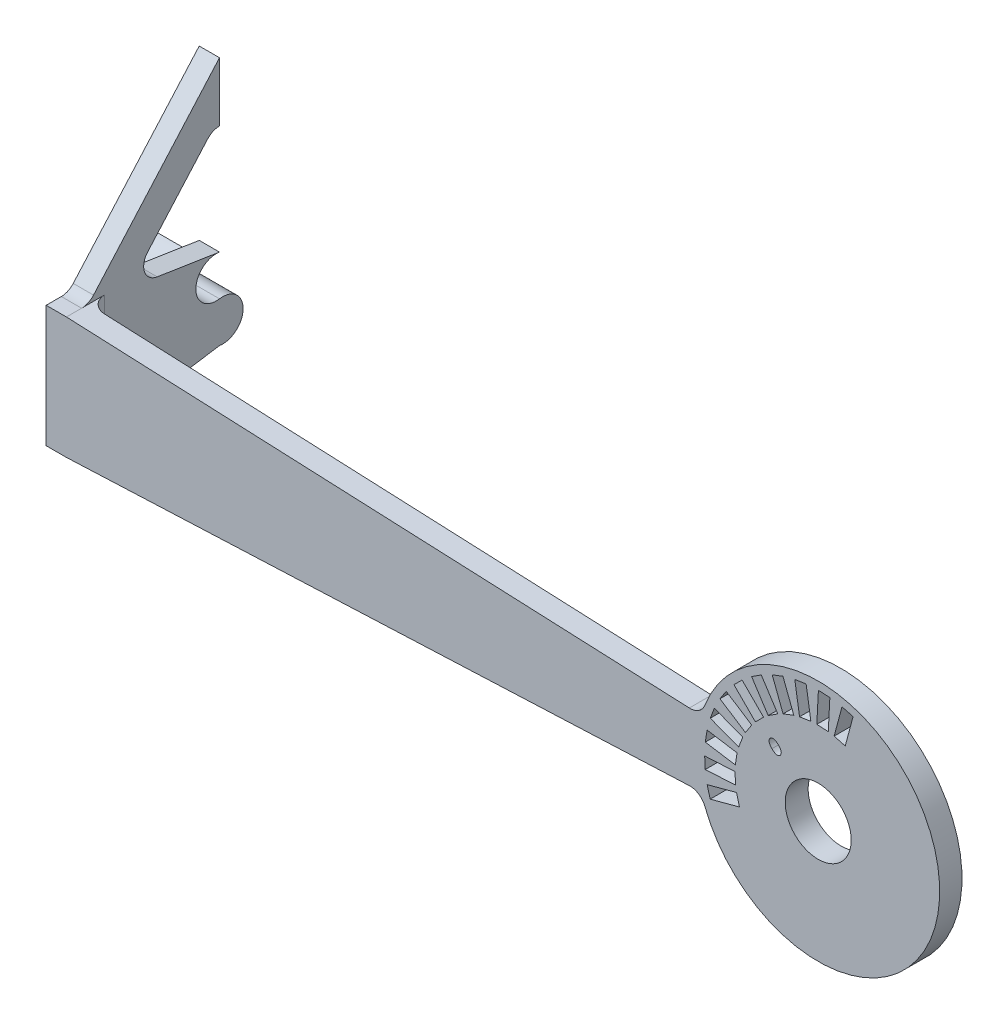
from build123d import *

# Parameters (mm, degrees)
SKETCH1_R           = 9.525
SKETCH1_R_2         = 5.175
BOSS_EXTRUDE1_DEPTH = 3.6
BOSS_EXTRUDE2_DEPTH = 3.5
SKETCH3_R           = 19.05
SKETCH3_R_2         = 5.175
BOSS_EXTRUDE3_DEPTH = 3.5
CUT_EXTRUDE1_DEPTH  = 95.573202468
BOSS_EXTRUDE4_DEPTH = 3.175
BOSS_EXTRUDE5_DEPTH = 6.35
BOSS_EXTRUDE6_DEPTH = 3.18
FILLET1_R           = 2.5


with BuildPart() as part:
    # Sketch1 → Boss-Extrude1 (new body)
    with BuildSketch(Plane.XY):
        with Locations((27.25, 7.75)):
            Circle(SKETCH1_R)
        with Locations((27.25, 7.75)):
            Circle(SKETCH1_R_2, mode=Mode.SUBTRACT)
    extrude(amount=-BOSS_EXTRUDE1_DEPTH)

    # Sketch2 → Boss-Extrude2 (add)
    with BuildSketch(Plane.XY):
        Polygon((18.995, 12.501904881), (-90.625, 17.288017443), (-90.625, -1.788017443), (18.995, 2.998095119), align=None)
    extrude(amount=-BOSS_EXTRUDE2_DEPTH)

    # Sketch3 → Boss-Extrude3 (add)
    with BuildSketch(Plane.XY):
        with Locations((27.25, 7.75)):
            Circle(SKETCH3_R)
        with Locations((27.25, 7.75)):
            Circle(SKETCH3_R_2, mode=Mode.SUBTRACT)
    extrude(amount=-BOSS_EXTRUDE3_DEPTH)

    # Sketch4 → Cut-Extrude1 (cut, through all)
    # profile 1 of 12: a face of its own
    with BuildSketch(Plane.XY):
        Polygon((19.405357851, 18.177218987), (16.811514446, 22.171387567), (18.321121469, 23.15173783), (20.914964873, 19.15756925), align=None)
    # profile 2 of 12: a face of its own
    with BuildSketch(Plane.XY):
        Polygon((17.408841373, 16.318366421), (18.681633579, 17.591158627), (15.314037534, 20.958754673), (14.041245327, 19.685962466), align=None)
    # profile 3 of 12: a face of its own
    with BuildSketch(Plane.XY):
        Polygon((21.744722833, 19.580352047), (20.037995473, 24.026528829), (21.718440241, 24.671591138), (23.425167601, 20.225414357), align=None)
    # profile 4 of 12: a face of its own
    with BuildSketch(Plane.XY):
        Polygon((24.324694845, 20.466441955), (23.579675705, 25.170307677), (25.357514718, 25.451889714), (26.102533858, 20.748023992), align=None)
    # profile 5 of 12: a face of its own
    with BuildSketch(Plane.XY):
        Polygon((27.032516729, 20.796762329), (27.281766721, 25.552735489), (29.079299883, 25.458530767), (28.830049892, 20.702557608), align=None)
    # profile 6 of 12: a face of its own
    with BuildSketch(Plane.XY):
        Polygon((29.749843676, 20.556876584), (30.982469378, 25.157098332), (32.721135866, 24.691224051), (31.488510163, 20.091002303), align=None)
    # profile 7 of 12: a face of its own
    with BuildSketch(Plane.XY):
        Polygon((15.84243075, 14.085035127), (11.84826217, 16.678878531), (12.828612433, 18.188485554), (16.822781013, 15.594642149), align=None)
    # profile 8 of 12: a face of its own
    with BuildSketch(Plane.XY):
        Polygon((14.774585643, 11.574832399), (10.328408862, 13.281559759), (10.973471171, 14.962004527), (15.419647953, 13.255277167), align=None)
    # profile 9 of 12: a face of its own
    with BuildSketch(Plane.XY):
        Polygon((14.251976008, 8.897466142), (9.548110286, 9.642485282), (9.829692323, 11.420324295), (14.533558045, 10.675305155), align=None)
    # profile 10 of 12: a face of its own
    with BuildSketch(Plane.XY):
        Polygon((14.297442392, 6.169950108), (9.541469233, 5.920700117), (9.447264511, 7.718233279), (14.203237671, 7.967483271), align=None)
    # profile 11 of 12: a face of its own
    with BuildSketch(Plane.XY):
        Polygon((14.908997697, 3.511489837), (10.308775949, 2.278864134), (9.842901668, 4.017530622), (14.443123416, 5.250156324), align=None)
    # profile 12 of 12: a face of its own
    with BuildSketch(Plane.XY):
        with BuildLine():
            add(Edge.make_bspline(
                [(19.996175693, 13.983105039), (19.972549804, 14.006974852), (19.926684107, 14.053314085), (19.862635122, 14.123340739), (19.804807719, 14.191245488), (19.753115011, 14.256928744), (19.706902346, 14.320187557), (19.667123485, 14.381475924), (19.633241886, 14.440499093), (19.605838218, 14.49786121), (19.583891907, 14.553730575), (19.565373741, 14.60828689), (19.550882076, 14.662068546), (19.540580443, 14.715204363), (19.534737441, 14.767524979), (19.532388566, 14.819113596), (19.53464102, 14.869868179), (19.540484051, 14.919643175), (19.550380726, 14.968074585), (19.563399735, 15.015027998), (19.579921539, 15.060371004), (19.600563009, 15.10350851), (19.62372625, 15.145488903), (19.651184569, 15.185108897), (19.681148524, 15.223804161), (19.703943722, 15.247425917), (19.715479913, 15.259380413)],
                knots=[0, 0, 0, 0, 1.644941701, 3.193378015, 4.647145852, 6.012736372, 7.286740979, 8.483061719, 9.58992218, 10.61798452, 11.593737178, 12.528549707, 13.438735705, 14.319919232, 15.176948591, 16.015348648, 16.846831638, 17.662602897, 18.467729349, 19.265590275, 20.047523624, 20.827953815, 21.605954429, 22.393232775, 23.186847407, 24, 24, 24, 24], degree=3))
            add(Edge.make_bspline(
                [(19.715479913, 15.259380413), (19.72757601, 15.271056951), (19.751480133, 15.294131948), (19.79059328, 15.32453002), (19.830653616, 15.352371474), (19.872934823, 15.376073956), (19.916815537, 15.396640202), (19.962550005, 15.413433609), (20.009989946, 15.427159873), (20.059028168, 15.437329522), (20.109640093, 15.443588369), (20.161391726, 15.446416818), (20.214253243, 15.443872509), (20.268139075, 15.438159389), (20.323009446, 15.427596366), (20.379119371, 15.413908829), (20.435954787, 15.394752005), (20.494277642, 15.372380194), (20.553991919, 15.345222785), (20.614763563, 15.31181632), (20.6768047, 15.272675401), (20.740699924, 15.228555913), (20.805586165, 15.178199697), (20.871982932, 15.122240246), (20.939915396, 15.060760529), (20.984561985, 15.016868227), (21.007443722, 14.994373068)],
                knots=[0, 0, 0, 0, 0.81750105, 1.615533254, 2.407168602, 3.189397808, 3.970901104, 4.762954563, 5.55742278, 6.372083968, 7.196957306, 8.037000563, 8.890477321, 9.76918381, 10.671577351, 11.607318308, 12.577284202, 13.587520184, 14.64617593, 15.76641423, 16.959043917, 18.21433275, 19.543145185, 20.953794228, 22.438794936, 24, 24, 24, 24], degree=3))
            add(Edge.make_bspline(
                [(21.007443722, 14.994373068), (21.029939345, 14.971491973), (21.07369258, 14.926989007), (21.134906952, 14.859351767), (21.190415056, 14.793244214), (21.24085702, 14.728727202), (21.285167215, 14.665378577), (21.324082766, 14.603618046), (21.35744776, 14.543475592), (21.384594418, 14.48417647), (21.406973112, 14.426279284), (21.426121387, 14.369867226), (21.439873538, 14.314050657), (21.450373252, 14.259306853), (21.456117386, 14.205282675), (21.45863553, 14.152136819), (21.455811599, 14.099963135), (21.449552444, 14.048928037), (21.439380503, 13.999468399), (21.425663125, 13.951600834), (21.408844197, 13.905459094), (21.388425087, 13.861212706), (21.364450808, 13.818808922), (21.336898184, 13.778413534), (21.306335612, 13.739270233), (21.283273208, 13.715357657), (21.271603044, 13.703257283)],
                knots=[0, 0, 0, 0, 1.562235313, 3.038495437, 4.440379466, 5.764626062, 7.024677084, 8.202776689, 9.317717587, 10.370816988, 11.375304419, 12.339374423, 13.269058028, 14.172047064, 15.051333417, 15.912249674, 16.759720868, 17.591966788, 18.41390586, 19.215513145, 20.014546285, 20.802808402, 21.585553806, 22.383400645, 23.181959475, 24, 24, 24, 24], degree=3))
            add(Edge.make_bspline(
                [(21.271603044, 13.703257283), (21.259629026, 13.691746239), (21.23604856, 13.66907751), (21.197734192, 13.638805411), (21.158183947, 13.611660672), (21.116515089, 13.588202529), (21.073534989, 13.567814799), (21.028537333, 13.551158533), (20.981994239, 13.538163004), (20.933989646, 13.528262893), (20.884634953, 13.522407258), (20.834167195, 13.520202748), (20.782683445, 13.522376174), (20.73042296, 13.5289079), (20.67731692, 13.539143901), (20.623181435, 13.553199413), (20.568109964, 13.571523386), (20.511768493, 13.594048796), (20.454021813, 13.622036447), (20.394346939, 13.655485363), (20.332806089, 13.695249792), (20.269074183, 13.740726075), (20.203509794, 13.792477155), (20.136108776, 13.850566204), (20.065946419, 13.913865736), (20.019874065, 13.959587171), (19.996175693, 13.983105039)],
                knots=[0, 0, 0, 0, 0.813987375, 1.602987522, 2.391074088, 3.163837422, 3.945068801, 4.721304689, 5.513312182, 6.312473106, 7.122201215, 7.947613738, 8.786874495, 9.645595022, 10.52768317, 11.43703601, 12.385957169, 13.371717227, 14.410080332, 15.530148071, 16.72394133, 18.000834515, 19.367826948, 20.817813834, 22.363169582, 24, 24, 24, 24], degree=3))
        make_face()
        with BuildLine():
            add(Edge.make_bspline(
                [(20.139491665, 14.120484847), (20.159842261, 14.10026479), (20.199282005, 14.06107803), (20.258825996, 14.006696987), (20.315157902, 13.956648767), (20.36946228, 13.91227584), (20.421015188, 13.872453316), (20.470698769, 13.838793642), (20.517294119, 13.809391318), (20.562274922, 13.785969667), (20.60570856, 13.766694324), (20.648080537, 13.750402661), (20.6900298, 13.737655615), (20.731300233, 13.728383676), (20.771914432, 13.721759849), (20.812064975, 13.718808576), (20.851623834, 13.719298353), (20.902639916, 13.723732634), (20.963368961, 13.736271903), (21.030845369, 13.761355865), (21.091551409, 13.796275379), (21.125667075, 13.82699342), (21.142703471, 13.842333137)],
                knots=[0, 0, 0, 0, 1.478828575, 2.865990936, 4.156734116, 5.36308544, 6.480889949, 7.513666501, 8.455984072, 9.319688948, 10.125381605, 10.904881632, 11.658652575, 12.383407565, 13.084213992, 13.778321268, 14.456017801, 15.121659285, 16.41638644, 17.638501444, 18.820734642, 20, 20, 20, 20], degree=3))
            add(Edge.make_bspline(
                [(21.142703471, 13.842333137), (21.158237309, 13.859333277), (21.189151543, 13.89316563), (21.223390961, 13.953683956), (21.248748637, 14.019779969), (21.261375212, 14.079417608), (21.265678182, 14.129451086), (21.266398281, 14.168334547), (21.262604874, 14.20785819), (21.256376505, 14.24827996), (21.246514017, 14.289516324), (21.233214252, 14.331341198), (21.217255365, 14.3741679), (21.20384511, 14.402126104), (21.196976975, 14.41644505)],
                knots=[0, 0, 0, 0, 1.339481627, 2.665731908, 4.025256516, 5.457778452, 6.202644314, 6.952873897, 7.722377096, 8.515238795, 9.337057588, 10.192268171, 11.074160362, 12, 12, 12, 12], degree=3))
            add(Edge.make_bspline(
                [(21.196976975, 14.41644505), (21.187973627, 14.434350806), (21.169636182, 14.47082011), (21.138179389, 14.524604008), (21.102557105, 14.578418398), (21.064470083, 14.633337931), (21.020981154, 14.687380173), (20.975094965, 14.742656801), (20.924859167, 14.797821639), (20.889404387, 14.83392842), (20.87133595, 14.852329131)],
                knots=[0, 0, 0, 0, 0.879877645, 1.792078736, 2.733637099, 3.713363695, 4.725250154, 5.778099888, 6.867676946, 8, 8, 8, 8], degree=3))
            add(Edge.make_bspline(
                [(20.87133595, 14.852329131), (20.85293091, 14.870394121), (20.817032712, 14.905629066), (20.762551079, 14.955367796), (20.709270708, 15.001073456), (20.657080441, 15.043043344), (20.605259068, 15.080077675), (20.554916646, 15.113936398), (20.50519563, 15.143058684), (20.456779694, 15.168776163), (20.409426539, 15.190288012), (20.363298462, 15.208334264), (20.31839389, 15.222725096), (20.274695443, 15.233953882), (20.232016746, 15.241307261), (20.190582362, 15.244613497), (20.150298797, 15.244724339), (20.099268913, 15.240215062), (20.039015716, 15.227597661), (19.972406236, 15.202799422), (19.911999572, 15.169092426), (19.878484301, 15.13852322), (19.861763968, 15.123272641)],
                knots=[0, 0, 0, 0, 1.331365774, 2.596768798, 3.807708333, 4.955277549, 6.052926775, 7.095188675, 8.086337056, 9.026368116, 9.92436562, 10.769928982, 11.582219143, 12.357378997, 13.097541491, 13.815019859, 14.500931769, 15.174783094, 16.457052075, 17.664667297, 18.834932833, 20, 20, 20, 20], degree=3))
            add(Edge.make_bspline(
                [(19.861763968, 15.123272641), (19.846235795, 15.106269619), (19.815119572, 15.072198013), (19.780593138, 15.01114956), (19.755313654, 14.944098329), (19.74268388, 14.88378236), (19.738333486, 14.833183193), (19.737770771, 14.79390012), (19.740933039, 14.754081851), (19.746875648, 14.713394638), (19.756141644, 14.672123078), (19.769056969, 14.630225368), (19.785373303, 14.587876991), (19.804420811, 14.544195974), (19.828111656, 14.499075995), (19.857227018, 14.452165818), (19.891065617, 14.402451645), (19.930829853, 14.350856026), (19.975390734, 14.296573577), (20.025112965, 14.239683187), (20.080125163, 14.180441993), (20.119308315, 14.140869004), (20.139491665, 14.120484847)],
                knots=[0, 0, 0, 0, 1.184098183, 2.372762314, 3.588199925, 4.868807811, 5.53452642, 6.205014416, 6.891934544, 7.591722619, 8.32367034, 9.070557309, 9.850147652, 10.662595738, 11.526400688, 12.475033872, 13.507930086, 14.625864108, 15.832355206, 17.128728501, 18.521000081, 20, 20, 20, 20], degree=3))
        make_face(mode=Mode.SUBTRACT)
    extrude(amount=-CUT_EXTRUDE1_DEPTH, mode=Mode.SUBTRACT)


with BuildPart() as cut_extrude1_kept_piece:
    # of the separate pieces the step leaves, the one the design keeps (cut_extrude1_pieces_kept)
    add(part.part.solids().sort_by_distance((8.921106691, 2.558259438, 0))[0])

    # Sketch5 → Boss-Extrude4 (add)
    with BuildSketch(Plane.ZY.offset(90.625)):
        with BuildLine():
            Line((0, 17.288017443), (-3.5, 17.288017443))
            Line((-3.5, 17.288017443), (-24, 14.1))
            ThreePointArc((-24, 14.1), (-20.29308285, 10.925), (-24, 7.75))
            ThreePointArc((-24, 7.75), (-27.70691715, 4.575), (-24, 1.4))
            Line((-24, 1.4), (-3.5, -1.788017443))
            Line((-3.5, -1.788017443), (0, -1.788017443))
            Line((0, -1.788017443), (0, 17.288017443))
        make_face()
    extrude(amount=BOSS_EXTRUDE4_DEPTH)

    # Sketch6 → Boss-Extrude5 (add)
    with BuildSketch(Plane.ZY.offset(93.8)):
        with BuildLine():
            ThreePointArc((-25.928379169, 1.699888118), (-24.975779061, 1.475419917), (-24, 1.4))
            ThreePointArc((-24, 1.4), (-19.509871939, 3.259871939), (-17.65, 7.75))
            ThreePointArc((-17.65, 7.75), (-18.873221883, 11.496818135), (-22.071620831, 13.800111882))
            ThreePointArc((-22.071620831, 13.800111882), (-20.444829224, 9.949220939), (-24, 7.75))
            ThreePointArc((-24, 7.75), (-27.555170776, 5.550779061), (-25.928379169, 1.699888118))
        make_face()
    extrude(amount=BOSS_EXTRUDE5_DEPTH)

    # Sketch9 → Boss-Extrude6 (add)
    with BuildSketch(Plane(origin=(-90.625, 0, 0), x_dir=(0, 0, -1), z_dir=(1, 0, 0))):
        Polygon((24, 40.4921875), (3.5, 17.288017443), (9.713960097, 16.32166558), (22.126436487, 30.371480848), (24, 32.4921875), align=None)
        with BuildLine():
            Line((24, 31.21625888), (24, 32.4921875))
            Line((24, 32.4921875), (22.126436487, 30.371480848))
            ThreePointArc((22.126436487, 30.371480848), (22.972394755, 30.995299788), (24, 31.21625888))
        make_face()
    extrude(amount=-BOSS_EXTRUDE6_DEPTH)

    # Fillet1
    # the kernel refuses this fillet: 2.5 mm, written as the material it adds along each edge
    with BuildSketch(Plane(origin=(-90.625, 17.288017443, -3.5), x_dir=(0, 0, 1), z_dir=(-1, 0, 0))) as fillet1_piece_1:
        with BuildLine():
            CenterArc((FILLET1_R * 0.450893725471, FILLET1_R), FILLET1_R, 221.45937079, 48.54062921)
            Line((-FILLET1_R * 0.29853167979, FILLET1_R * 0.337911212941), (0, 0))
            Line((0, 0), (FILLET1_R * 0.450893725471, 0))
        make_face()
    extrude(amount=3.175)
    with BuildSketch(Plane(origin=(-90.625, 16.32166558, -9.713960097), x_dir=(0, -0.15366599387417892, -0.9881228477910329), z_dir=(-1, 0, 0))) as fillet1_piece_2:
        with BuildLine():
            CenterArc((FILLET1_R * 1.82729194014, -FILLET1_R), FILLET1_R, 90, 122.61993432)
            Line((FILLET1_R * 0.98502704299, -FILLET1_R * 1.53906385803), (0, 0))
            Line((0, 0), (FILLET1_R * 1.82729194014, 0))
        make_face()
    extrude(amount=3.175)
    with BuildSketch(Plane(origin=(-90.625, 23.538017443, -3.5), x_dir=(1, 0, 0), z_dir=(0, -1, 0))) as fillet1_piece_3_section:
        with BuildLine():
            CenterArc((FILLET1_R, -FILLET1_R), FILLET1_R, 90, 90)
            Line((0, -FILLET1_R), (0, 0))
            Line((0, 0), (FILLET1_R, 0))
        make_face()
    fillet1_piece_3 = extrude(amount=31.576034886, mode=Mode.PRIVATE)
    fillet1_piece_3 = split(fillet1_piece_3, bisect_by=Plane(origin=(-89.653341221, 17.245593904, -4.057124871), z_dir=(-0.043619387365339574, -0.9990482215818577, 0)), keep=Keep.TOP, mode=Mode.PRIVATE)
    fillet1_piece_3 = split(fillet1_piece_3, bisect_by=Plane(origin=(-89.650267131, -1.745459687, -4.057124871), z_dir=(-0.0436193873653328, 0.9990482215818579, 0)), keep=Keep.TOP, mode=Mode.PRIVATE)
    fillet1_piece_3 = split(fillet1_piece_3, bisect_by=Plane(origin=(-90.066387829, -1.477366772, -5.49758592), z_dir=(0, 0.9881228477910331, 0.15366599387417806)), keep=Keep.TOP, mode=Mode.PRIVATE)
    add(fillet1_piece_3)
    with BuildSketch(Plane(origin=(8.921106691, 2.558259438, -3.5), x_dir=(0.31692008603336363, -0.9484522439578101, 0), z_dir=(0, 0, 1))) as fillet1_piece_4:
        with BuildLine():
            CenterArc((1.88545219, -2.497302737), FILLET1_R, 92.661756664, 71.361476718)
            Line((-0.517981279, -1.80918388), (0, 0))
            ThreePointArc((0, 0), (0.884676459, -0.020553146), (1.769352917, 0))
        make_face()
    extrude(amount=3.5)
    with BuildSketch(Plane(origin=(8.921106691, 12.941740562, -3.5), x_dir=(0.31692008603337163, 0.9484522439578075, 0), z_dir=(0, 0, 1))) as fillet1_piece_5:
        with BuildLine():
            CenterArc((1.88545219, 2.497302737), FILLET1_R, 195.976766619, 71.361476718)
            Line((-0.517981279, 1.80918388), (0, 0))
            ThreePointArc((0, 0), (0.884676459, 0.020553146), (1.769352917, 0))
        make_face()
    extrude(amount=3.5)


solid = cut_extrude1_kept_piece.part
